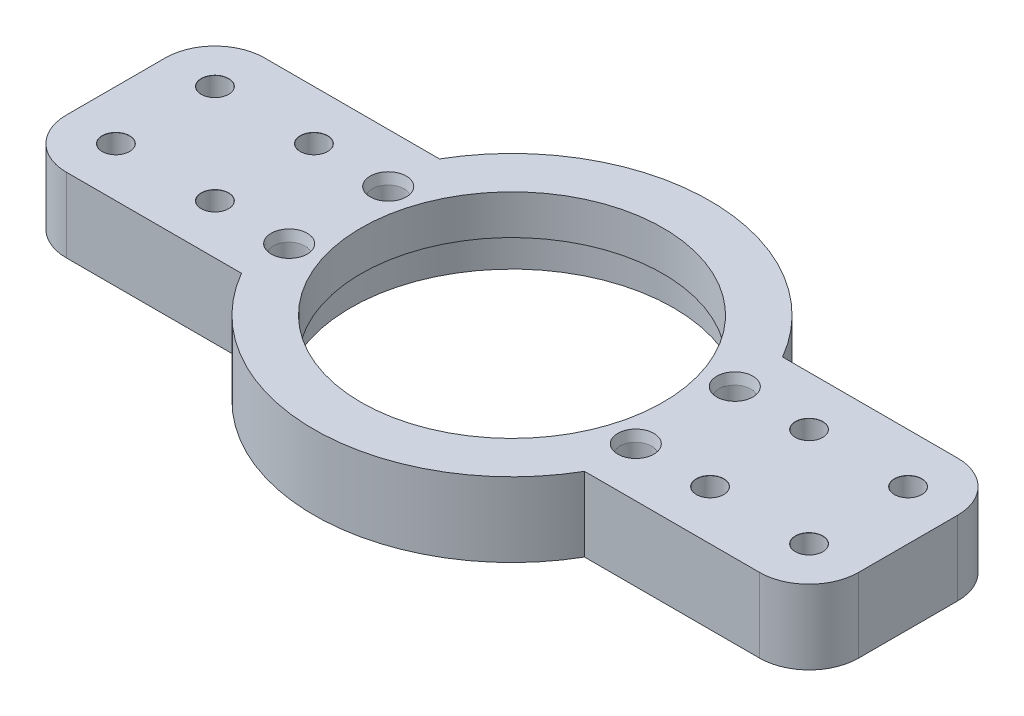
from build123d import *
from OCP.BRepFilletAPI import BRepFilletAPI_MakeChamfer

# Parameters (mm, degrees)
BOSS_EXTRUDE1_DEPTH = 15
CUT_EXTRUDE3_REACH  = 92.692
SKETCH4_R           = 30.5
SKETCH3_R           = 32.6
CUT_EXTRUDE4_DEPTH  = 7
FILLET1_R           = 10
HOLE1_D             = 6.4
HOLE1_CBORE_D       = 7.3
HOLE1_CBORE_DEPTH   = 2
CHAMFER1_SIZE       = 0.45
CHAMFER1_SIZE_2     = 2


# Read off the part's stored shape, not the designer's step: M5 Clearance Hole1
with BuildPart() as part:
    # Sketch1 → Boss-Extrude1 (new body)
    with BuildSketch(Plane(origin=(0, 0, 0), x_dir=(1, 0, 0), z_dir=(0, 1, 0))):
        with BuildLine():
            ThreePointArc((34.641016151, 20), (0, 40), (-34.641016151, 20))
            Line((-34.641016151, 20), (34.641016151, 20))
        make_face()
        with BuildLine():
            Line((34.641016151, 20), (-34.641016151, 20))
            ThreePointArc((-34.641016151, 20), (-40, 0), (-34.641016151, -20))
            Line((-34.641016151, -20), (34.641016151, -20))
            ThreePointArc((34.641016151, -20), (38.637033052, -10.352761804), (40, 0))
            ThreePointArc((40, 0), (38.637033052, 10.352761804), (34.641016151, 20))
        make_face()
        with BuildLine():
            Line((-34.641016151, 20), (-80, 20))
            Line((-80, 20), (-80, -20))
            Line((-80, -20), (-34.641016151, -20))
            ThreePointArc((-34.641016151, -20), (-40, 0), (-34.641016151, 20))
        make_face()
        with BuildLine():
            Line((80, 20), (34.641016151, 20))
            ThreePointArc((34.641016151, 20), (38.637033052, 10.352761804), (40, 0))
            ThreePointArc((40, 0), (38.637033052, -10.352761804), (34.641016151, -20))
            Line((34.641016151, -20), (80, -20))
            Line((80, -20), (80, 20))
        make_face()
        with BuildLine():
            Line((34.641016151, -20), (-34.641016151, -20))
            ThreePointArc((-34.641016151, -20), (0, -40), (34.641016151, -20))
        make_face()
    extrude(amount=BOSS_EXTRUDE1_DEPTH)

    # Sketch4 → Cut-Extrude3 (cut, up to next)
    with BuildSketch(Plane(origin=(0, 15, 0), x_dir=(1, 0, 0), z_dir=(0, 1, 0)), mode=Mode.PRIVATE) as cut_extrude3_sk1:
        with Locations(Location((0, 0, 0), (0, 0, 270))):
            Circle(SKETCH4_R)
    cut_extrude3_tool1 = extrude(cut_extrude3_sk1.sketch, amount=-CUT_EXTRUDE3_REACH, mode=Mode.PRIVATE) & part.part
    add(cut_extrude3_tool1.solids().sort_by_distance((0, 15, 0))[0], mode=Mode.SUBTRACT)

    # Sketch3 → Cut-Extrude4 (cut)
    with BuildSketch(Plane.XZ):
        with Locations(Location((0, 0, 0), (0, 0, 270))):
            Circle(SKETCH3_R)
    extrude(amount=-CUT_EXTRUDE4_DEPTH, mode=Mode.SUBTRACT)

    # M5 Clearance Hole1 outline → M5 Clearance Hole1 (revolve, cut)
    with BuildSketch(Plane(origin=(70, 0, -10), x_dir=(1, 0, 0), z_dir=(0, 0, 1))):
        Polygon((0, 0), (2.75, 0), (2.75, 14.975), (2.775, 15), (0, 15), align=None)
    revolve(axis=Axis((70, 0, -10), (0, 1, 0)), mode=Mode.SUBTRACT)

    # M5 Clearance Hole1 2 outline → M5 Clearance Hole1 2 (revolve, cut)
    with BuildSketch(Plane(origin=(50, 0, 10), x_dir=(1, 0, 0), z_dir=(0, 0, 1))):
        Polygon((0, 0), (2.75, 0), (2.75, 14.975), (2.775, 15), (0, 15), align=None)
    revolve(axis=Axis((50, 0, 10), (0, 1, 0)), mode=Mode.SUBTRACT)

    # M5 Clearance Hole1 3 outline → M5 Clearance Hole1 3 (revolve, cut)
    with BuildSketch(Plane(origin=(70, 0, 10), x_dir=(1, 0, 0), z_dir=(0, 0, 1))):
        Polygon((0, 0), (2.75, 0), (2.75, 14.975), (2.775, 15), (0, 15), align=None)
    revolve(axis=Axis((70, 0, 10), (0, 1, 0)), mode=Mode.SUBTRACT)

    # M5 Clearance Hole1 4 outline → M5 Clearance Hole1 4 (revolve, cut)
    with BuildSketch(Plane(origin=(50, 0, -10), x_dir=(1, 0, 0), z_dir=(0, 0, 1))):
        Polygon((0, 0), (2.75, 0), (2.75, 14.975), (2.775, 15), (0, 15), align=None)
    revolve(axis=Axis((50, 0, -10), (0, 1, 0)), mode=Mode.SUBTRACT)

    # M5 Clearance Hole1 5 outline → M5 Clearance Hole1 5 (revolve, cut)
    with BuildSketch(Plane(origin=(-50, 0, -10), x_dir=(1, 0, 0), z_dir=(0, 0, 1))):
        Polygon((0, 0), (2.75, 0), (2.75, 14.975), (2.775, 15), (0, 15), align=None)
    revolve(axis=Axis((-50, 0, -10), (0, 1, 0)), mode=Mode.SUBTRACT)

    # M5 Clearance Hole1 6 outline → M5 Clearance Hole1 6 (revolve, cut)
    with BuildSketch(Plane(origin=(-70, 0, 10), x_dir=(1, 0, 0), z_dir=(0, 0, 1))):
        Polygon((0, 0), (2.75, 0), (2.75, 14.975), (2.775, 15), (0, 15), align=None)
    revolve(axis=Axis((-70, 0, 10), (0, 1, 0)), mode=Mode.SUBTRACT)

    # M5 Clearance Hole1 7 outline → M5 Clearance Hole1 7 (revolve, cut)
    with BuildSketch(Plane(origin=(-50, 0, 10), x_dir=(1, 0, 0), z_dir=(0, 0, 1))):
        Polygon((0, 0), (2.75, 0), (2.75, 14.975), (2.775, 15), (0, 15), align=None)
    revolve(axis=Axis((-50, 0, 10), (0, 1, 0)), mode=Mode.SUBTRACT)

    # M5 Clearance Hole1 8 outline → M5 Clearance Hole1 8 (revolve, cut)
    with BuildSketch(Plane(origin=(-70, 0, -10), x_dir=(1, 0, 0), z_dir=(0, 0, 1))):
        Polygon((0, 0), (2.75, 0), (2.75, 14.975), (2.775, 15), (0, 15), align=None)
    revolve(axis=Axis((-70, 0, -10), (0, 1, 0)), mode=Mode.SUBTRACT)

    # Fillet1
    fillet1_edges = [part.edges().sort_by_distance(p)[0] for p in [
        (80, 7.5, -20),
        (80, 7.5, 20),
        (-80, 7.5, 20),
        (-80, 7.5, -20),
    ]]
    fillet(fillet1_edges, radius=FILLET1_R)

    # Hole1 (through all)
    with Locations(Plane(origin=(0, 15, 0), x_dir=(1, 0, 0), z_dir=(0, 1, 0))):
        with Locations((35, -10), (-35, 10), (-35, -10), (35, 10)):
            CounterBoreHole(HOLE1_D / 2, HOLE1_CBORE_D / 2, HOLE1_CBORE_DEPTH)

    # Chamfer1
    chamfer1_edges_1 = [part.edges().sort_by_distance(p)[0] for p in [
        (31.35, 13, 10),
    ]]
    chamfer1_side_1 = [part.faces().sort_by_distance(p)[0] for p in [
        (31.359, 13, 10),
    ]]
    chamfer1_edges_2 = [part.edges().sort_by_distance(p)[0] for p in [
        (31.35, 13, -10),
    ]]
    chamfer1_side_2 = [part.faces().sort_by_distance(p)[0] for p in [
        (31.359, 13, -10),
    ]]
    chamfer1_edges_3 = [part.edges().sort_by_distance(p)[0] for p in [
        (-38.65, 13, 10),
    ]]
    chamfer1_side_3 = [part.faces().sort_by_distance(p)[0] for p in [
        (-38.641, 13, 10),
    ]]
    chamfer1_edges_4 = [part.edges().sort_by_distance(p)[0] for p in [
        (-38.65, 13, -10),
    ]]
    chamfer1_side_4 = [part.faces().sort_by_distance(p)[0] for p in [
        (-38.641, 13, -10),
    ]]
    chamfer1 = BRepFilletAPI_MakeChamfer(part.part.solid().wrapped)
    for e in chamfer1_edges_1:
        chamfer1.Add(CHAMFER1_SIZE - 0.0001, CHAMFER1_SIZE_2 - 0.0001, e.wrapped, chamfer1_side_1[0].wrapped)
    for e in chamfer1_edges_2:
        chamfer1.Add(CHAMFER1_SIZE - 0.0001, CHAMFER1_SIZE_2 - 0.0001, e.wrapped, chamfer1_side_2[0].wrapped)
    for e in chamfer1_edges_3:
        chamfer1.Add(CHAMFER1_SIZE - 0.0001, CHAMFER1_SIZE_2 - 0.0001, e.wrapped, chamfer1_side_3[0].wrapped)
    for e in chamfer1_edges_4:
        chamfer1.Add(CHAMFER1_SIZE - 0.0001, CHAMFER1_SIZE_2 - 0.0001, e.wrapped, chamfer1_side_4[0].wrapped)
    add(Compound.cast(chamfer1.Shape()), mode=Mode.REPLACE)  # a hair under: the kernel refuses the full size


solid = part.part
